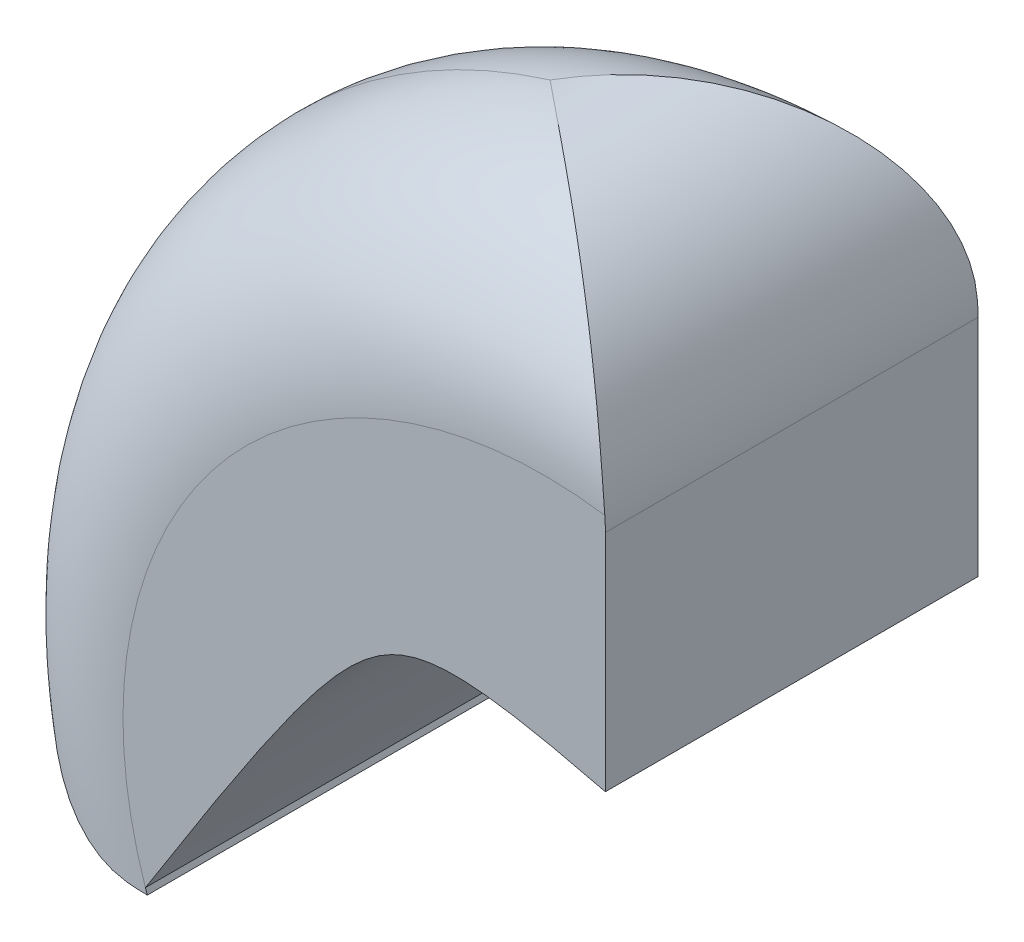
from build123d import *

# Parameters (mm, degrees)
BOSS_EXTRUDE1_DEPTH = 5.08
FILLET1_R           = 2.54
CUT_EXTRUDE1_DEPTH  = 5.08
SCALE1_SCALE        = 0.8


with BuildPart() as part:
    # Sketch2 → Boss-Extrude1 (new body)
    with BuildSketch(Plane.XY):
        with BuildLine():
            Line((0, 0), (-8.89, 0))
            ThreePointArc((-8.89, 0), (-7.067912046, 7.37504804), (0, 10.16))
            Line((0, 10.16), (0, 0))
        make_face()
    extrude(amount=BOSS_EXTRUDE1_DEPTH)

    # Fillet1
    fillet1_edges = [part.edges().sort_by_distance(p)[0] for p in [
        (-7.067912046, 7.37504804, 0),
        (-8.89, 0, 2.54),
        (0, 10.16, 2.54),
        (-7.067912046, 7.37504804, 5.08),
    ]]
    fillet(fillet1_edges, radius=FILLET1_R - 0.0001)  # a hair under: the kernel refuses the full size

    # Sketch4 → Cut-Extrude1 (cut)
    with BuildSketch(Plane.XY):
        with BuildLine():
            Line((0, 4.342456755), (0, 0))
            Line((0, 0), (-6.244672338, 0))
            Line((-6.244672338, 0), (-6.270779923, 0.075057389))
            add(Edge.make_bspline(
                [(-6.270779923, 0.075057389), (-3.105835382, 5.113383938), (0, 4.342456755)],
                knots=[0, 0, 0, 1, 1, 1], degree=2, weights=[1, 3, 1]))
        make_face()
    extrude(amount=CUT_EXTRUDE1_DEPTH, mode=Mode.SUBTRACT)


with BuildPart() as part_1:
    # Scale1: scaled about (0, 0, 0)
    add(part.part.scale(SCALE1_SCALE))


solid = part_1.part
